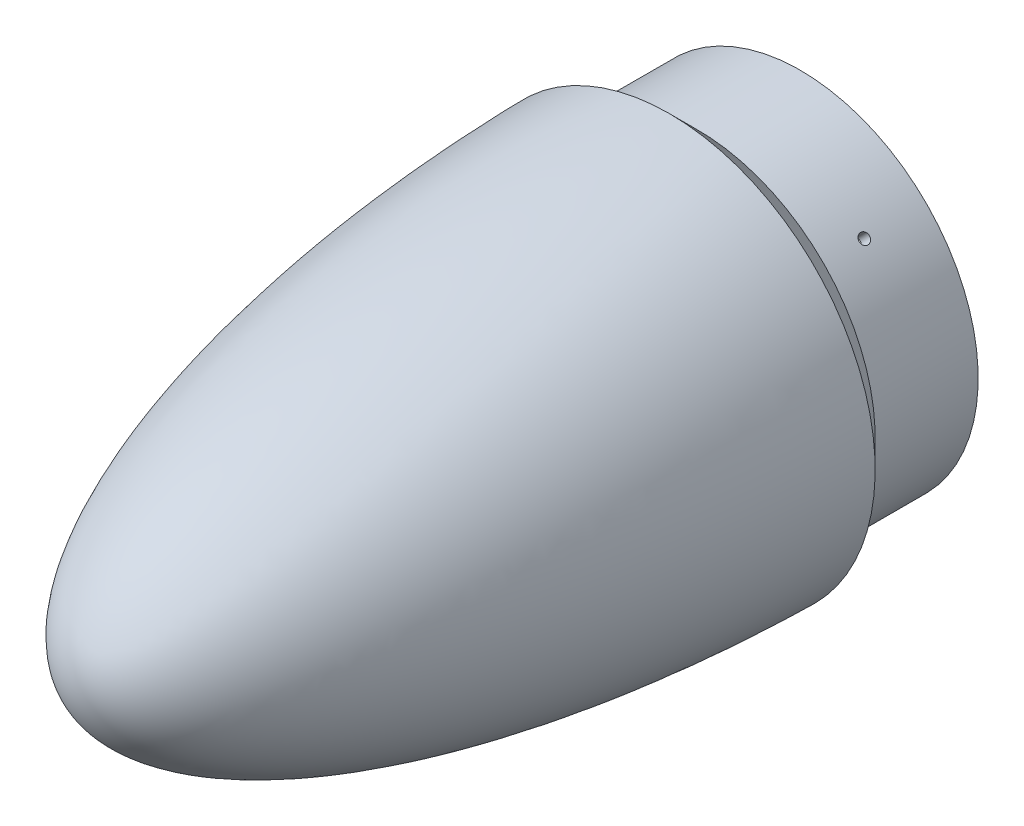
from build123d import *

# Parameters (mm, degrees)
UPPER_AIRFRAME_COUPLER_SKETCH_R      = 43.15
UPPER_AIRFRAME_COUPLER_SKETCH_R_2    = 39.975
UPPER_AIRFRAME_COUPLER_EXTRUDE_DEPTH = 25
SHEAR_PIN_BORE_CUT_REACH             = 190.276
SHEAR_PIN_BORE_CUT_END_RADIUS        = 39.975
SHEAR_PIN_BORE_SKETCH_R              = 1.25
SHEAR_PIN_PATTERN_COUNT              = 4


with BuildPart() as part:
    # Ellipsoid Sketch → Ellipsoid Revolve (revolve)
    with BuildSketch(Plane(origin=(0, 0, 0), x_dir=(0, 0, -1), z_dir=(1, 0, 0))):
        with BuildLine():
            Line((-150, 0), (-139.975, 0))
            add(Edge.make_bspline(
                [(0, 39.975), (-139.975, 39.975), (-139.975, 0)],
                knots=[4.71238898, 4.71238898, 4.71238898, 6.283185307, 6.283185307, 6.283185307], degree=2, weights=[1, 0.707106781, 1]))
            Line((0, 39.975), (0, 50))
            add(Edge.make_bspline(
                [(0, 50), (-150, 50), (-150, 0)],
                knots=[4.71238898, 4.71238898, 4.71238898, 6.283185307, 6.283185307, 6.283185307], degree=2, weights=[1, 0.707106781, 1]))
        make_face()
    revolve(axis=Axis((0, 0, -7.5), (0, 0, 1)))

    # Upper Airframe Coupler Sketch → Upper Airframe Coupler Extrude (add)
    with BuildSketch(Plane(origin=(0, 0, 0), x_dir=(-1, 0, 0), z_dir=(0, 0, -1))):
        Circle(UPPER_AIRFRAME_COUPLER_SKETCH_R)
        Circle(UPPER_AIRFRAME_COUPLER_SKETCH_R_2, mode=Mode.SUBTRACT)
    extrude(amount=UPPER_AIRFRAME_COUPLER_EXTRUDE_DEPTH)

    # Upper Airframe Mate Chamfer: read off the stored shape, not the designer's step
    # Upper Airframe Mate Chamfer outline → Upper Airframe Mate Chamfer (revolve, cut)
    with BuildSketch(Plane.XZ):
        Polygon((49.948616721, 6.798616721), (43.15, 0), (50, 0), (50, 6.798616721), align=None)
    revolve(axis=Axis((0, 0, 0), (0, 0, 1)), mode=Mode.SUBTRACT)

    # Shear Pin Bore Cut: up to this cylinder (the profile starts outside it)
    shear_pin_bore_cut_end = Plane(origin=(0, 0, -10), z_dir=(0, 0, -1)) * Cylinder(SHEAR_PIN_BORE_CUT_END_RADIUS, 461.502, mode=Mode.PRIVATE)
    # Shear Pin Bore Sketch → Shear Pin Bore Cut (cut, up to the surface)
    with BuildSketch(Plane(origin=(30.511657608, -30.511657608, 0), x_dir=(-0.7071067811865475, -0.7071067811865477, 0), z_dir=(0.7071067811865477, -0.7071067811865475, 0)), mode=Mode.PRIVATE) as shear_pin_bore_cut_sk1:
        with Locations(Location((0, 10, 0), (0, 0, 180))):
            Circle(SHEAR_PIN_BORE_SKETCH_R)
    shear_pin_bore_cut_tool1 = extrude(shear_pin_bore_cut_sk1.sketch, amount=-SHEAR_PIN_BORE_CUT_REACH, mode=Mode.PRIVATE) - shear_pin_bore_cut_end
    shear_pin_bore_cut = shear_pin_bore_cut_tool1.solids().sort_by_distance((30.511658, -30.511658, -10))[0]
    add(shear_pin_bore_cut, mode=Mode.SUBTRACT)

    # Shear Pin Pattern: Shear Pin Bore Cut ×4 about axis
    shear_pin_pattern_axis = Axis((0, 0, 0), (0, 0, 1))
    for i in range(1, SHEAR_PIN_PATTERN_COUNT):
        add(shear_pin_bore_cut.rotate(shear_pin_pattern_axis, i * 360 / SHEAR_PIN_PATTERN_COUNT), mode=Mode.SUBTRACT)


solid = part.part
